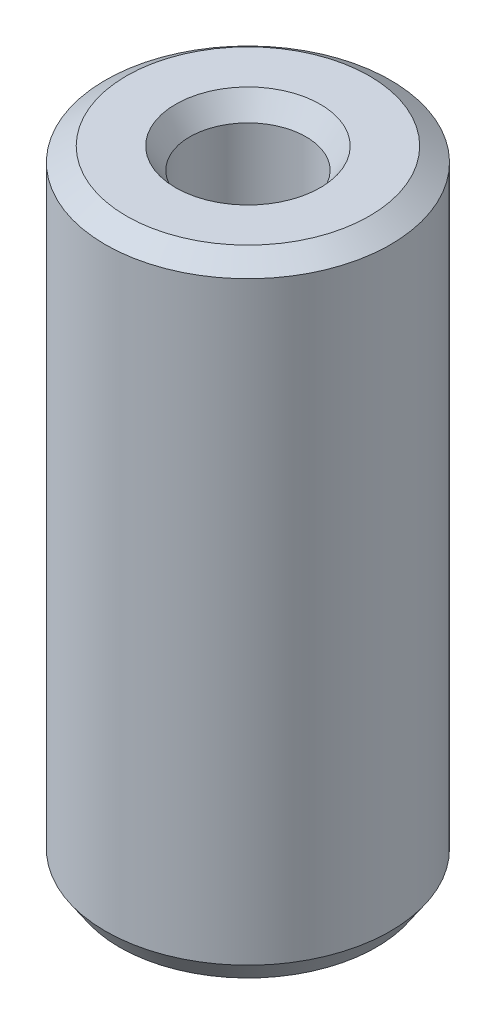
from build123d import *
from OCP.BRepFilletAPI import BRepFilletAPI_MakeChamfer

# Parameters (mm, degrees)
SKETCH1_R           = 40
BOSS_EXTRUDE1_DEPTH = 176.740717101
SKETCH2_R           = 16.315946503
CUT_EXTRUDE1_DEPTH  = 186.572845755
CHAMFER1_SIZE       = 3.983672546
CHAMFER1_SIZE2      = 5.917237268


with BuildPart() as part:
    # Sketch1 → Boss-Extrude1 (new body)
    with BuildSketch(Plane(origin=(0, 0, 0), x_dir=(1, 0, 0), z_dir=(0, 1, 0))):
        Circle(SKETCH1_R)
    extrude(amount=BOSS_EXTRUDE1_DEPTH)

    # Sketch2 → Cut-Extrude1 (cut, through all)
    with BuildSketch(Plane(origin=(0, 0, 0), x_dir=(1, 0, 0), z_dir=(0, 1, 0))):
        Circle(SKETCH2_R)
    extrude(amount=CUT_EXTRUDE1_DEPTH, mode=Mode.SUBTRACT)

    # Chamfer1: one chamfer whose edges measure the first distance from different faces: ONE call of the kernel's chamfer builder (chamfer() names one face for all edges)
    chamfer1_edges_1 = [part.edges().sort_by_distance(p)[0] for p in [
        (-16.315946503, 176.740717101, 0),
    ]]
    chamfer1_side_1 = [part.faces().sort_by_distance(p)[0] for p in [
        (-38.86862915, 176.740717101, 0),
    ]]
    chamfer1_edges_2 = [part.edges().sort_by_distance(p)[0] for p in [
        (-16.315946503, 0, 0),
    ]]
    chamfer1_side_2 = [part.faces().sort_by_distance(p)[0] for p in [
        (-16.315946503, 88.370358551, 0),
    ]]
    chamfer1_edges_3 = [part.edges().sort_by_distance(p)[0] for p in [
        (-40, 0, 0),
    ]]
    chamfer1_side_3 = [part.faces().sort_by_distance(p)[0] for p in [
        (-38.86862915, 0, 0),
    ]]
    chamfer1_edges_4 = [part.edges().sort_by_distance(p)[0] for p in [
        (-40, 176.740717101, 0),
    ]]
    chamfer1_side_4 = [part.faces().sort_by_distance(p)[0] for p in [
        (-40, 88.370358551, 0),
    ]]
    chamfer1 = BRepFilletAPI_MakeChamfer(part.part.solid().wrapped)
    for e in chamfer1_edges_1:
        chamfer1.Add(CHAMFER1_SIZE, CHAMFER1_SIZE2, e.wrapped, chamfer1_side_1[0].wrapped)  # the first distance lies on this face
    for e in chamfer1_edges_2:
        chamfer1.Add(CHAMFER1_SIZE, CHAMFER1_SIZE2, e.wrapped, chamfer1_side_2[0].wrapped)  # the first distance lies on this face
    for e in chamfer1_edges_3:
        chamfer1.Add(CHAMFER1_SIZE, CHAMFER1_SIZE2, e.wrapped, chamfer1_side_3[0].wrapped)  # the first distance lies on this face
    for e in chamfer1_edges_4:
        chamfer1.Add(CHAMFER1_SIZE, CHAMFER1_SIZE2, e.wrapped, chamfer1_side_4[0].wrapped)  # the first distance lies on this face
    add(Compound.cast(chamfer1.Shape()), mode=Mode.REPLACE)


solid = part.part
